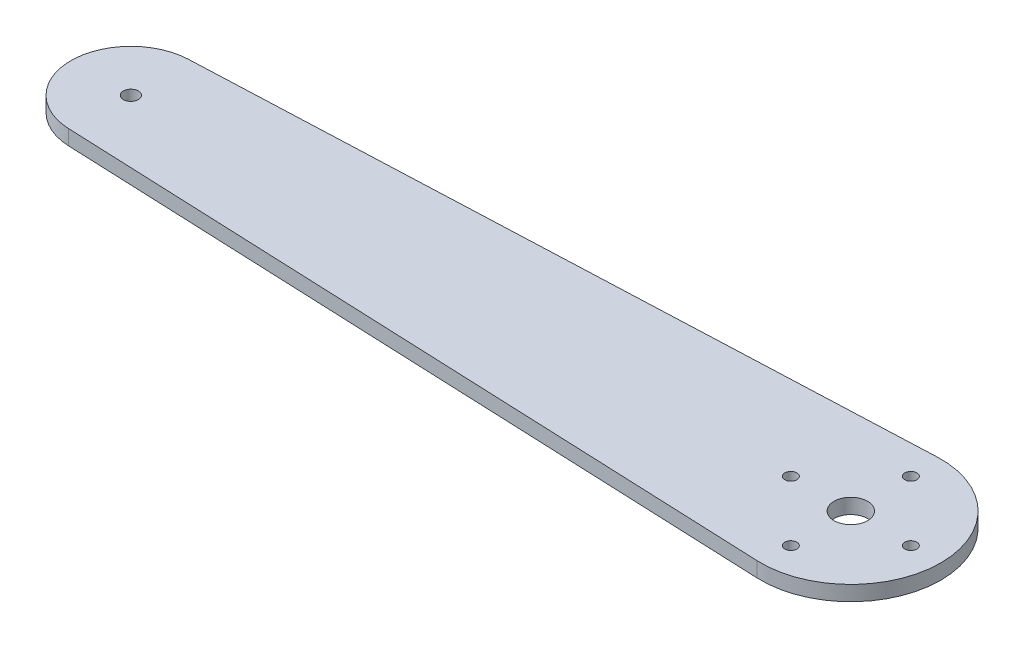
from build123d import *

# Parameters (mm, degrees)
SKETCH1_R           = 1.5875
SKETCH1_R_2         = 3.556
SKETCH1_R_3         = 1.27
BOSS_EXTRUDE1_DEPTH = 3.175


with BuildPart() as part:
    # Sketch1 → Boss-Extrude1 (new body)
    with BuildSketch(Plane(origin=(0, 0, 0), x_dir=(1, 0, 0), z_dir=(0, 1, 0))):
        with BuildLine():
            Line((-152.929166667, 12.688970905), (-0.79375, 19.033456358))
            ThreePointArc((-0.79375, 19.033456358), (19.05, 0), (-0.79375, -19.033456358))
            Line((-0.79375, -19.033456358), (-152.929166667, -12.688970905))
            ThreePointArc((-152.929166667, -12.688970905), (-165.1, 0), (-152.929166667, 12.688970905))
        make_face()
        with Locations((-152.4, 0)):
            Circle(SKETCH1_R, mode=Mode.SUBTRACT)
        Circle(SKETCH1_R_2, mode=Mode.SUBTRACT)
        with Locations((0, 12.7)):
            Circle(SKETCH1_R_3, mode=Mode.SUBTRACT)
        with Locations((12.7, 0)):
            Circle(SKETCH1_R_3, mode=Mode.SUBTRACT)
        with Locations((0, -12.7)):
            Circle(SKETCH1_R_3, mode=Mode.SUBTRACT)
        with Locations((-12.7, 0)):
            Circle(SKETCH1_R_3, mode=Mode.SUBTRACT)
    extrude(amount=BOSS_EXTRUDE1_DEPTH)


solid = part.part
